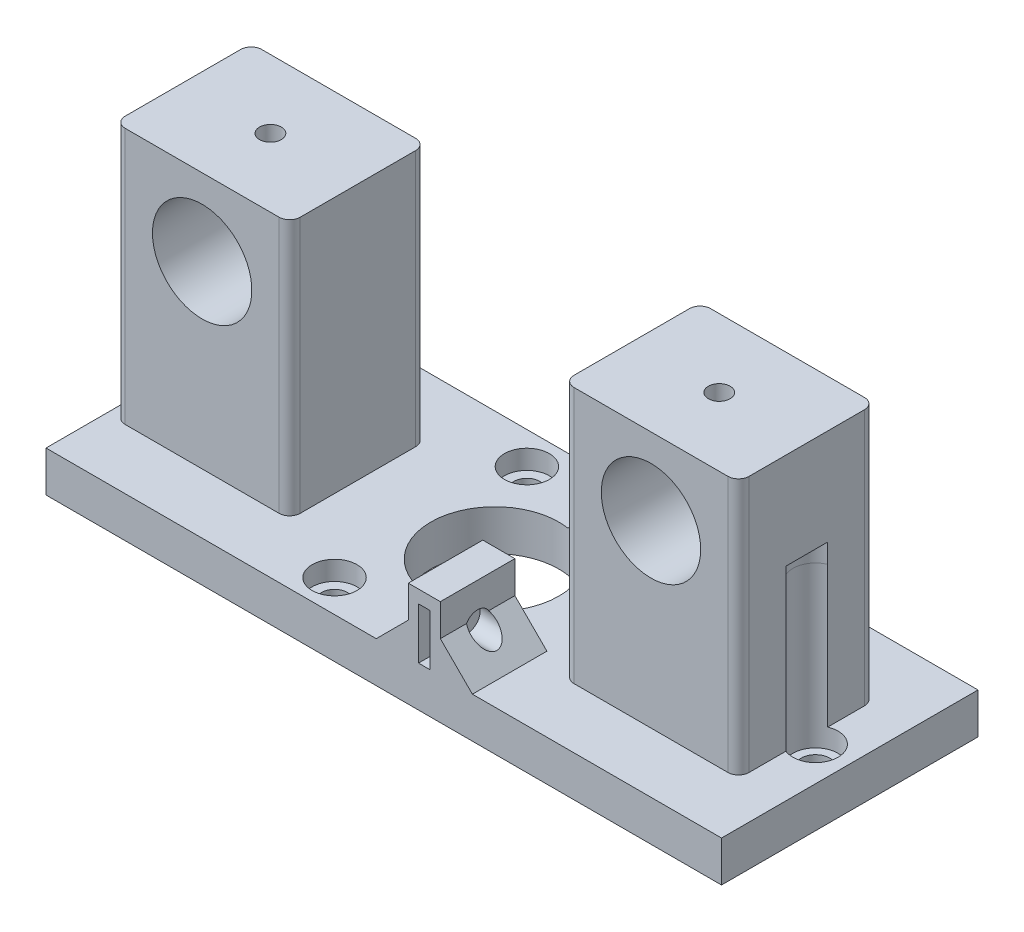
from build123d import *
from build123d.topology import SkipClean

# Parameters (mm, degrees)
SKETCH1_W                = 100
SKETCH1_H                = 80
SKETCH1_R                = 10
SKETCH1_R_2              = 1.65
BOSS_EXTRUDE1_DEPTH      = 6.35
SKETCH3_R                = 2
CUT_EXTRUDE5_DEPTH       = 65.345337826
BOSS_EXTRUDE2_DEPTH      = 6.35
SKETCH6_W                = 105.351133128
SKETCH6_H                = 40
CUT_EXTRUDE6_DEPTH       = 69.586226304
SKETCH7_R                = 3.5
CUT_EXTRUDE7_DEPTH       = 3
BOSS_EXTRUDE4_START      = -6.35
BOSS_EXTRUDE4_DEPTH      = 46.35
SKETCH9_R                = 3.497663505
CUT_EXTRUDE8_DEPTH       = 25
CUT_EXTRUDE9_START       = 25
SKETCH10_R               = 3.529979832
SKETCH10_R_2             = 2
CUT_EXTRUDE9_DEPTH       = 25
SKETCH12_R               = 2.238504643
CUT_EXTRUDE10_DEPTH      = 25
SKETCH13_R               = 7.75
CUT_EXTRUDE11_DEPTH      = 25
SKETCH14_R               = 1.7
CUT_EXTRUDE12_DEPTH      = 10
SKETCH16_W               = 1.6
SKETCH16_H               = 11.621506057
BOSS_EXTRUDE5_DEPTH      = 8
CHAMFER1_SIZE            = 5
CHAMFER2_SIZE            = 5
CUT_EXTRUDE13_DEPTH      = 8
CUT_EXTRUDE13_DEPTH_BACK = 1.6
SKETCH17_R               = 2
SKETCH18_W               = 5
SKETCH18_H               = 11.621506057
BOSS_EXTRUDE6_DEPTH      = 2


with BuildPart() as part:
    # Sketch1 → Boss-Extrude1 (new body)
    with BuildSketch(Plane(origin=(0, 0, 0), x_dir=(1, 0, 0), z_dir=(0, 1, 0))):
        Rectangle(SKETCH1_W, SKETCH1_H)
        with Locations(Location((0, -20, 0), (0, 0, 270))):
            Circle(SKETCH1_R, mode=Mode.SUBTRACT)
        with Locations(Location((23, -29, 0), (0, 0, 270))):
            Circle(SKETCH1_R_2, mode=Mode.SUBTRACT)
        with Locations(Location((47, -11, 0), (0, 0, 270))):
            Circle(SKETCH1_R_2, mode=Mode.SUBTRACT)
        with Locations(Location((23, -11, 0), (0, 0, 270))):
            Circle(SKETCH1_R_2, mode=Mode.SUBTRACT)
        with Locations(Location((47, -29, 0), (0, 0, 270))):
            Circle(SKETCH1_R_2, mode=Mode.SUBTRACT)
        with Locations(Location((-23, -29, 0), (0, 0, 90))):
            Circle(SKETCH1_R_2, mode=Mode.SUBTRACT)
        with Locations(Location((-47, -29, 0), (0, 0, 90))):
            Circle(SKETCH1_R_2, mode=Mode.SUBTRACT)
        with Locations(Location((-47, -11, 0), (0, 0, 90))):
            Circle(SKETCH1_R_2, mode=Mode.SUBTRACT)
        with Locations(Location((-23, -11, 0), (0, 0, 90))):
            Circle(SKETCH1_R_2, mode=Mode.SUBTRACT)
    extrude(amount=BOSS_EXTRUDE1_DEPTH)

    # Sketch3 → Cut-Extrude5 (cut, through all)
    with BuildSketch(Plane(origin=(0, 6.35, 0), x_dir=(1, 0, 0), z_dir=(0, 1, 0))):
        with Locations((50, -20)):
            Circle(SKETCH3_R)
        with Locations(Location((-10, -35, 0), (0, 0, 270))):
            Circle(SKETCH3_R)
        with Locations(Location((-10, -5, 0), (0, 0, 90))):
            Circle(SKETCH3_R)
    extrude(amount=-CUT_EXTRUDE5_DEPTH, mode=Mode.SUBTRACT)

    # Sketch5 → Boss-Extrude2 (add)
    with SkipClean():  # the faces are left unmerged after this step: merging them gives an invalid solid
        with BuildSketch(Plane(origin=(0, 6.35, 0), x_dir=(1, 0, 0), z_dir=(0, 1, 0))):
            with BuildLine():
                Line((50, -22), (50, -40))
                Line((50, -40), (55.351133128, -40))
                Line((55.351133128, -40), (55.351133128, 40))
                Line((55.351133128, 40), (50, 40))
                Line((50, 40), (50, -18))
                ThreePointArc((50, -18), (52, -20), (50, -22))
            make_face()
        extrude(amount=-BOSS_EXTRUDE2_DEPTH)

    # Sketch6 → Cut-Extrude6 (cut, through all)
    with SkipClean():  # the faces are left unmerged after this step: merging them gives an invalid solid
        with BuildSketch(Plane(origin=(0, 6.35, 0), x_dir=(1, 0, 0), z_dir=(0, 1, 0))):
            with Locations((2.675566564, 20)):
                Rectangle(SKETCH6_W, SKETCH6_H)
        extrude(amount=-CUT_EXTRUDE6_DEPTH, mode=Mode.SUBTRACT)

    # Sketch7 → Cut-Extrude7 (cut)
    with SkipClean():  # the faces are left unmerged after this step: merging them gives an invalid solid
        with BuildSketch(Plane(origin=(0, 6.35, 0), x_dir=(1, 0, 0), z_dir=(0, 1, 0))):
            with Locations(Location((-10, -5, 0), (0, 0, 270))):
                Circle(SKETCH7_R)
            with Locations(Location((-10, -35, 0), (0, 0, 270))):
                Circle(SKETCH7_R)
            with Locations(Location((50, -20, 0), (0, 0, 270))):
                Circle(SKETCH7_R)
        extrude(amount=-CUT_EXTRUDE7_DEPTH, mode=Mode.SUBTRACT)

    # Sketch8 → Boss-Extrude4 (add)
    with BuildSketch(Plane(origin=(0, 6.35, 0), x_dir=(1, 0, 0), z_dir=(0, 1, 0)).offset(BOSS_EXTRUDE4_START)):
        with BuildLine():
            Line((-47, -9.35), (-23, -9.35))
            ThreePointArc((-23, -9.35), (-21.833273811, -9.833273811), (-21.35, -11))
            Line((-21.35, -11), (-21.35, -29))
            ThreePointArc((-21.35, -29), (-21.833273811, -30.166726189), (-23, -30.65))
            Line((-23, -30.65), (-47, -30.65))
            ThreePointArc((-47, -30.65), (-48.166726189, -30.166726189), (-48.65, -29))
            Line((-48.65, -29), (-48.65, -11))
            ThreePointArc((-48.65, -11), (-48.166726189, -9.833273811), (-47, -9.35))
        make_face()
        with BuildLine():
            Line((21.35, -11), (21.35, -29))
            ThreePointArc((21.35, -29), (21.833273811, -30.166726189), (23, -30.65))
            Line((23, -30.65), (47, -30.65))
            ThreePointArc((47, -30.65), (48.166726189, -30.166726189), (48.65, -29))
            Line((48.65, -29), (48.65, -11))
            ThreePointArc((48.65, -11), (48.166726189, -9.833273811), (47, -9.35))
            Line((47, -9.35), (23, -9.35))
            ThreePointArc((23, -9.35), (21.833273811, -9.833273811), (21.35, -11))
        make_face()
    extrude(amount=BOSS_EXTRUDE4_DEPTH)

    # Sketch9 → Cut-Extrude8 (cut)
    with BuildSketch(Plane(origin=(0, 6.35, 0), x_dir=(1, 0, 0), z_dir=(0, 1, 0))):
        with Locations((50, -20)):
            Circle(SKETCH9_R)
    extrude(amount=CUT_EXTRUDE8_DEPTH, mode=Mode.SUBTRACT)

    # Sketch10 → Cut-Extrude9 (cut)
    with BuildSketch(Plane(origin=(0, 3.35, 0), x_dir=(1, 0, 0), z_dir=(0, 1, 0)).offset(CUT_EXTRUDE9_START)):
        with Locations(Location((50, -20, 0), (0, 0, 112.484807611))):
            Circle(SKETCH10_R)
        with Locations((50, -20)):
            Circle(SKETCH10_R_2, mode=Mode.SUBTRACT)
    extrude(amount=-CUT_EXTRUDE9_DEPTH, mode=Mode.SUBTRACT)

    # Sketch12 → Cut-Extrude10 (cut)
    with BuildSketch(Plane.XZ):
        with Locations(Location((50, 20, 0), (0, 0, 270))):
            Circle(SKETCH12_R)
    extrude(amount=-CUT_EXTRUDE10_DEPTH, mode=Mode.SUBTRACT)

    # Sketch13 → Cut-Extrude11 (cut)
    with BuildSketch(Plane.XY.offset(30.65)):
        with Locations((35, 34.35)):
            Circle(SKETCH13_R)
        with Locations(Location((-35, 34.35, 0), (0, 0, 180))):
            Circle(SKETCH13_R)
    extrude(amount=-CUT_EXTRUDE11_DEPTH, mode=Mode.SUBTRACT)

    # Sketch14 → Cut-Extrude12 (cut)
    with BuildSketch(Plane(origin=(0, 46.35, 0), x_dir=(1, 0, 0), z_dir=(0, 1, 0))):
        with Locations(Location((35, -20, 0), (0, 0, 270))):
            Circle(SKETCH14_R)
        with Locations(Location((-35, -20, 0), (0, 0, 270))):
            Circle(SKETCH14_R)
    extrude(amount=-CUT_EXTRUDE12_DEPTH, mode=Mode.SUBTRACT)

    # Sketch16 → Boss-Extrude5 (add)
    with BuildSketch(Plane(origin=(0, 6.35, 0), x_dir=(1, 0, 0), z_dir=(0, 1, 0))):
        with Locations((10.7, -34.189246971)):
            Rectangle(SKETCH16_W, SKETCH16_H)
        with Locations((7.3, -5.810753029)):
            Rectangle(SKETCH16_W, SKETCH16_H)
        with Locations((10.7, -5.810753029)):
            Rectangle(SKETCH16_W, SKETCH16_H)
        with Locations((7.3, -34.189246971)):
            Rectangle(SKETCH16_W, SKETCH16_H)
    extrude(amount=BOSS_EXTRUDE5_DEPTH)

    # Chamfer1
    chamfer1_edges = [part.edges().sort_by_distance(p)[0] for p in [
        (11.5, 6.35, 5.810753029),
        (11.5, 6.35, 34.189246971),
    ]]
    chamfer(chamfer1_edges, length=CHAMFER1_SIZE)

    # Chamfer2
    # the kernel refuses this chamfer: 5 mm, written as the material it adds along each edge
    with BuildSketch(Plane(origin=(6.5, 6.35, 0), x_dir=(0.027495876610586317, 0.9996219169112968, 0), z_dir=(0, 0, 1))) as chamfer2_piece_1_section:
        Polygon((CHAMFER2_SIZE * 0.999621916911, CHAMFER2_SIZE * 0.0274958766106), (-CHAMFER2_SIZE * 0.0274958766106, CHAMFER2_SIZE * 0.999621916911), (0, 0), align=None)
    chamfer2_piece_1 = extrude(amount=11.621506057, mode=Mode.PRIVATE)
    chamfer2_piece_1 = chamfer2_piece_1 - Plane(origin=(0, 8.026002071, 20), x_dir=(0, 0, 1), z_dir=(0, -1, 0)) * Cylinder(10, 44, mode=Mode.PRIVATE)
    add(chamfer2_piece_1)
    with BuildSketch(Plane(origin=(6.5, 6.35, 28.378493943), x_dir=(0.027495876610586317, 0.9996219169112968, 0), z_dir=(0, 0, 1))) as chamfer2_piece_2_section:
        Polygon((CHAMFER2_SIZE * 0.999621916911, CHAMFER2_SIZE * 0.0274958766106), (-CHAMFER2_SIZE * 0.0274958766106, CHAMFER2_SIZE * 0.999621916911), (0, 0), align=None)
    chamfer2_piece_2 = extrude(amount=11.621506057, mode=Mode.PRIVATE)
    chamfer2_piece_2 = chamfer2_piece_2 - Plane(origin=(0, 8.026002093, 20), x_dir=(0, 0, 1), z_dir=(0, -1, 0)) * Cylinder(10, 44, mode=Mode.PRIVATE)
    add(chamfer2_piece_2)

    # Sketch17 → Cut-Extrude13 (cut, two sides: drawn at the far end of the back side and taken through both)
    with BuildSketch(Plane(origin=(11.5, 0, 0), x_dir=(0, 0, -1), z_dir=(1, 0, 0)).offset(-CUT_EXTRUDE13_DEPTH_BACK)):
        with Locations(Location((-5.810753029, 10.35, 0), (0, 0, 150))):
            Circle(SKETCH17_R)
        with Locations(Location((-34.189246971, 10.35, 0), (0, 0, 150))):
            Circle(SKETCH17_R)
    extrude(amount=CUT_EXTRUDE13_DEPTH + CUT_EXTRUDE13_DEPTH_BACK, mode=Mode.SUBTRACT)

    # Sketch18 → Boss-Extrude6 (add)
    with BuildSketch(Plane(origin=(0, 14.35, 0), x_dir=(1, 0, 0), z_dir=(0, 1, 0))):
        with Locations((9, -5.810753029)):
            Rectangle(SKETCH18_W, SKETCH18_H)
        with Locations((9, -34.189246971)):
            Rectangle(SKETCH18_W, SKETCH18_H)
    extrude(amount=BOSS_EXTRUDE6_DEPTH)


solid = part.part
